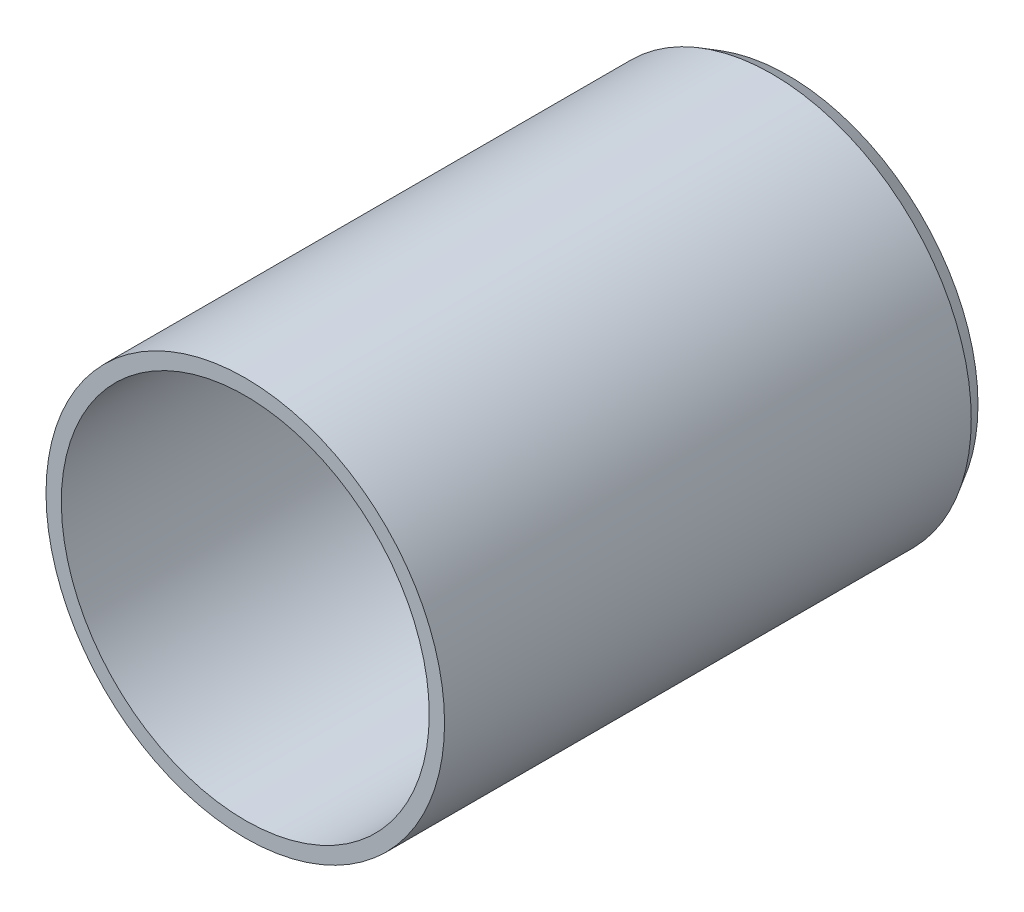
from build123d import *

# Parameters (mm, degrees)
RING_1MM_R          = 65
RING_1MM_R_2        = 60
BOSS_EXTRUDE1_DEPTH = 170
CUT_EXTRUDE2_START  = -240
CUT_EXTRUDE2_DEPTH  = 240
CIRPATTERN1_COUNT   = 6
CHAMFER1_SIZE       = 3
CHAMFER1_SIZE2      = 5.196152423


with BuildPart() as part:
    # Sketch1 → Revolve1 (revolve)
    with BuildSketch(Plane(origin=(0, 0, 0), x_dir=(-1, 0, 0), z_dir=(0, 1, 0))):
        Polygon((19.25, 8), (16.5, 9.5), (16.5, 20), (19.5, 20), (22, 2), (65, 2), (65, 0), (65, -5), (19.65625, -5), align=None)
    revolve(axis=Axis((0, 0, 20), (0, 0, -1)))

    # ring-1mm → Boss-Extrude1 (add)
    with BuildSketch(Plane.XY.offset(2)):
        Circle(RING_1MM_R)
        Circle(RING_1MM_R_2, mode=Mode.SUBTRACT)
    extrude(amount=BOSS_EXTRUDE1_DEPTH)

    # Sketch3-base-openings → Cut-Extrude2 (cut)
    with BuildSketch(Plane.XY.offset(2).offset(CUT_EXTRUDE2_START)):
        with BuildLine():
            Line((22.474178755, 8.179932107), (54.469759174, 19.825371007))
            ThreePointArc((54.469759174, 19.825371007), (56.030166948, 19.743756615), (57.055654614, 18.564812861))
            ThreePointArc((57.055654614, 18.564812861), (60, 0), (57.055654614, -18.564812861))
            ThreePointArc((57.055654614, -18.564812861), (56.030166948, -19.743756615), (54.469759174, -19.825371007))
            Line((54.469759174, -19.825371007), (22.474178755, -8.179932107))
            ThreePointArc((22.474178755, -8.179932107), (21.382429199, -7.220639488), (21.228367455, -5.775501293))
            ThreePointArc((21.228367455, -5.775501293), (22, 0), (21.228367455, 5.775501293))
            ThreePointArc((21.228367455, 5.775501293), (21.382429199, 7.220639488), (22.474178755, 8.179932107))
        make_face()
    cut_extrude2 = extrude(amount=CUT_EXTRUDE2_DEPTH, mode=Mode.SUBTRACT)

    # CirPattern1: Cut-Extrude2 ×6 about axis
    cirpattern1_axis = Axis((0, 0, 2), (0, 0, 1))
    for i in range(1, CIRPATTERN1_COUNT):
        add(cut_extrude2.rotate(cirpattern1_axis, i * 360 / CIRPATTERN1_COUNT), mode=Mode.SUBTRACT)

    # Chamfer1
    chamfer1_edges = [part.edges().sort_by_distance(p)[0] for p in [
        (65, 0, -5),
    ]]
    chamfer1_side = [part.faces().sort_by_distance(p)[0] for p in [
        (63.161522369, 0, -5),
    ]]
    chamfer(chamfer1_edges, length=CHAMFER1_SIZE, length2=CHAMFER1_SIZE2, reference=chamfer1_side[0])


solid = part.part
